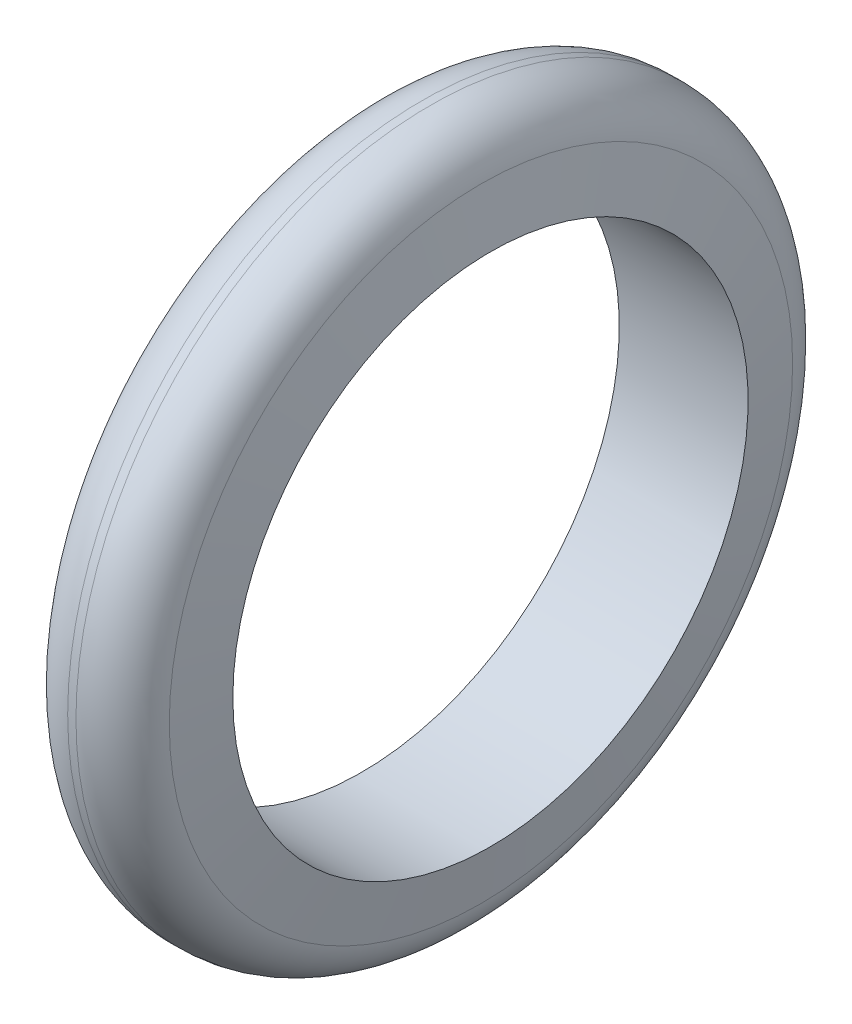
from build123d import *

# Parameters (mm, degrees)
FILLET1_R = 8


with BuildPart() as part:
    # Sketch1 → Revolve1 (revolve)
    with BuildSketch(Plane.XY):
        Polygon((-7.355095289, 55), (7.355095289, 55), (10, 40), (-10, 40), align=None)
    revolve(axis=Axis((0, 0, 0), (1, 0, 0)))

    # Fillet1
    fillet1_edges = [part.edges().sort_by_distance(p)[0] for p in [
        (7.355095289, -55, 0),
        (-7.355095289, -55, 0),
    ]]
    fillet(fillet1_edges, radius=FILLET1_R)


solid = part.part
